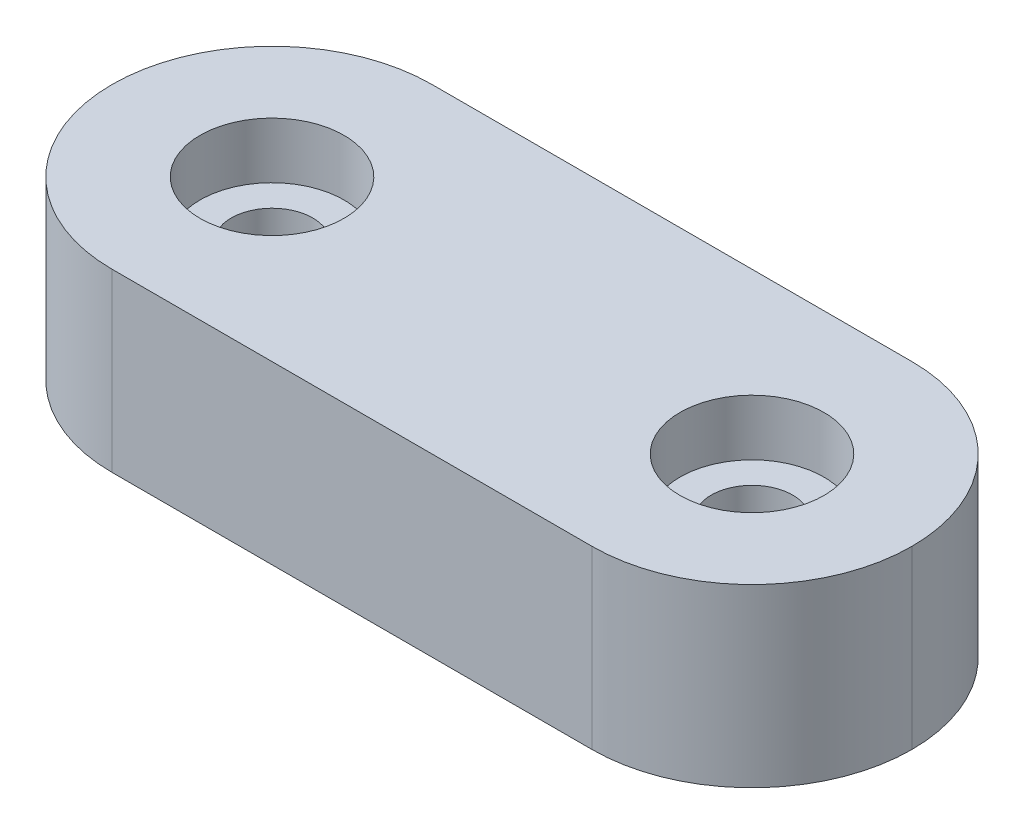
from build123d import *

# Parameters (mm, degrees)
SKETCH_1_W             = 100
SKETCH_1_H             = 40
EXTRUDE_1_DEPTH        = 22
HOLE_WIZARD_M121_D     = 10.2
HOLE_WIZARD_M121_DEPTH = 26.75
HOLE_WIZARD_M121_TIP   = 3.064389157
SKETCH_5_R             = 9
CUT_EXTRUDE_1_DEPTH    = 7
FILLET_1_R             = 20


with BuildPart() as part:
    # Эскиз1 → Бобышка-Вытянуть1 (new body)
    with BuildSketch(Plane(origin=(0, 0, 0), x_dir=(1, 0, 0), z_dir=(0, 1, 0))):
        Rectangle(SKETCH_1_W, SKETCH_1_H)
    extrude(amount=EXTRUDE_1_DEPTH)

    # Отверстие обработанное метчиком M121
    with Locations(Plane(origin=(-30, 22, 0), x_dir=(0, 0, 1), z_dir=(0, 1, 0))):
        with Locations((0, 0), (0, 60)):
            Hole(HOLE_WIZARD_M121_D / 2, depth=HOLE_WIZARD_M121_DEPTH)
            with Locations((0, 0, -(HOLE_WIZARD_M121_DEPTH + HOLE_WIZARD_M121_TIP / 2))):  # 118° drill point
                Cone(0, HOLE_WIZARD_M121_D / 2, HOLE_WIZARD_M121_TIP, mode=Mode.SUBTRACT)

    # Эскиз5 → Вырез-Вытянуть1 (cut)
    with BuildSketch(Plane(origin=(0, 22, 0), x_dir=(1, 0, 0), z_dir=(0, 1, 0))):
        with Locations(Location((30, 0, 0), (0, 0, 270))):
            Circle(SKETCH_5_R)
        with Locations(Location((-30, 0, 0), (0, 0, 270))):
            Circle(SKETCH_5_R)
    extrude(amount=-CUT_EXTRUDE_1_DEPTH, mode=Mode.SUBTRACT)

    # Скругление1
    fillet_1_edges = [part.edges().sort_by_distance(p)[0] for p in [
        (50, 11, 20),
        (50, 11, -20),
        (-50, 11, -20),
        (-50, 11, 20),
    ]]
    fillet(fillet_1_edges, radius=FILLET_1_R - 0.0001)  # a hair under: the kernel refuses the full size


solid = part.part
